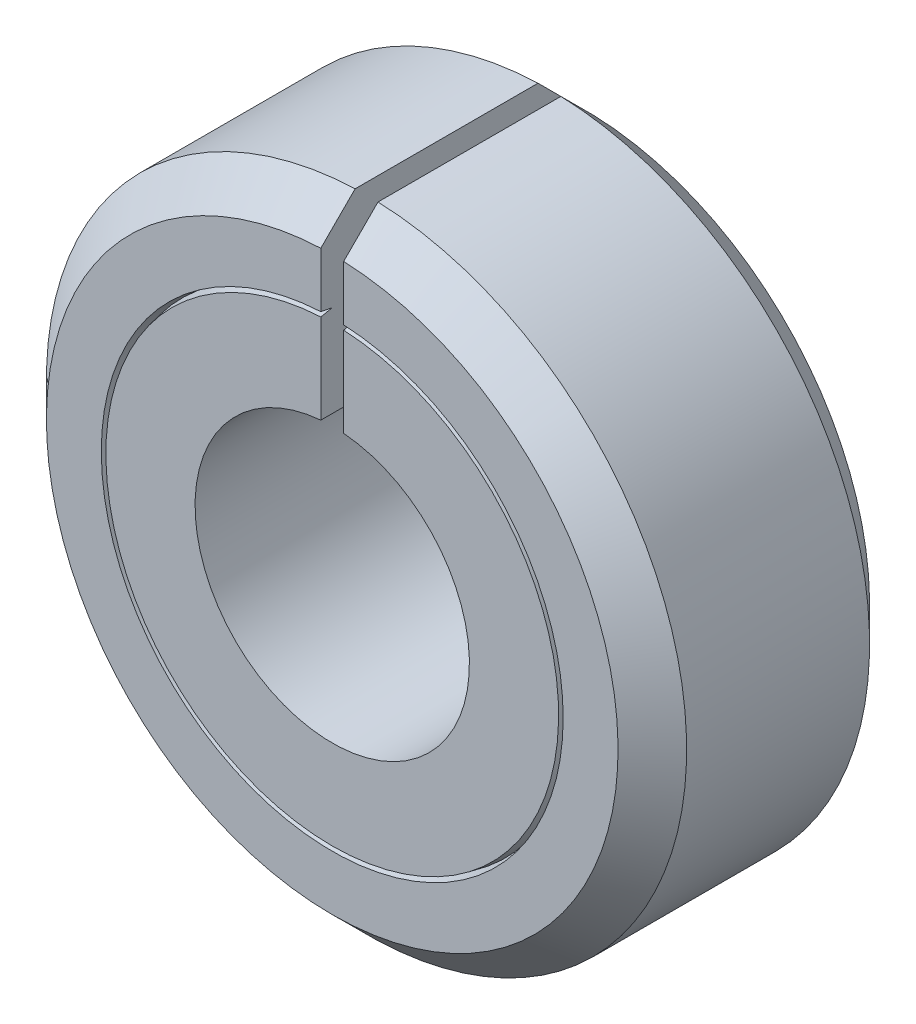
from build123d import *

# Parameters (mm, degrees)
SKETCH3_W          = 1
SKETCH3_H          = 14
CUT_EXTRUDE2_DEPTH = 15


with BuildPart() as part:
    # Sketch1 → Revolve1 (revolve)
    with BuildSketch(Plane(origin=(0, 0, 0), x_dir=(0, 0, -1), z_dir=(1, 0, 0))):
        Polygon((-5.5, 9.9), (-5.5, 6), (5.5, 6), (5.5, 9.9), (5, 10), (5.5, 10.1), (5.5, 12.5), (4, 14), (-4, 14), (-5.5, 12.5), (-5.5, 10.1), (-5, 10), align=None)
    revolve(axis=Axis((0, 0, 10.112306333), (0, 0, -1)))

    # Sketch3 → Cut-Extrude2 (cut, symmetric)
    with BuildSketch(Plane.XY):
        with Locations((0, 7)):
            Rectangle(SKETCH3_W, SKETCH3_H)
    extrude(amount=CUT_EXTRUDE2_DEPTH, both=True, mode=Mode.SUBTRACT)


solid = part.part
